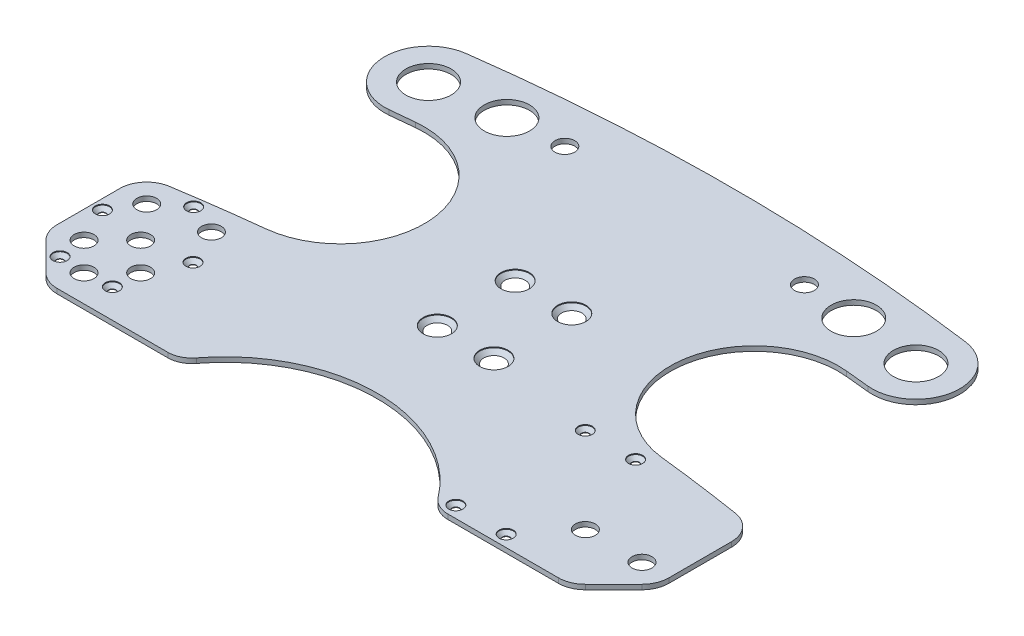
from build123d import *

# Parameters (mm, degrees)
SKETCH1_R                                      = 2.5
BOSS_EXTRUDE1_DEPTH                            = 1.7
CUT_EXTRUDE1_REACH                             = 155.062
SKETCH2_R                                      = 3.5
SKETCH2_R_2                                    = 8
CUT_EXTRUDE2_REACH                             = 155.062
SKETCH3_R                                      = 1.3
CUT_EXTRUDE3_REACH                             = 136.744
SKETCH8_R                                      = 1.25
CSK_FOR_M5_FLAT_HEAD_MACHINE_SCREW1_AT_2_COUNT = 2
CSK_FOR_M5_FLAT_HEAD_MACHINE_SCREW1_AT_2_PITCH = 20
CSK_FOR_M5_FLAT_HEAD_MACHINE_SCREW1_AT_3_COUNT = 2
CSK_FOR_M5_FLAT_HEAD_MACHINE_SCREW1_AT_3_PITCH = 34.003676272
CSK_FOR_M5_FLAT_HEAD_MACHINE_SCREW1_AT_4_COUNT = 2
CSK_FOR_M5_FLAT_HEAD_MACHINE_SCREW1_AT_4_PITCH = 27.5
CSK_FOR_M2_5_FLAT_HEAD_MACHINE_SCREW1_AT_COUNT = 2
CSK_FOR_M2_5_FLAT_HEAD_MACHINE_SCREW1_AT_PITCH = 17.78
CSK_FOR_M2_5_FLAT_HEAD_MACHINE_SCREW_2_COUNT   = 2
CSK_FOR_M2_5_FLAT_HEAD_MACHINE_SCREW_2_PITCH   = 49.055548106
CSK_FOR_M2_5_FLAT_HEAD_MACHINE_SCREW_3_COUNT   = 2
CSK_FOR_M2_5_FLAT_HEAD_MACHINE_SCREW_3_PITCH   = 45.72
CSK_FOR_M2_5_FLAT_HEAD_MACHINE_SCREW_4_COUNT   = 2
CSK_FOR_M2_5_FLAT_HEAD_MACHINE_SCREW_4_PITCH   = 137.555030632
CSK_FOR_M2_5_FLAT_HEAD_MACHINE_SCREW_5_COUNT   = 2
CSK_FOR_M2_5_FLAT_HEAD_MACHINE_SCREW_5_PITCH   = 122.005515158
CSK_FOR_M2_5_FLAT_HEAD_MACHINE_SCREW_6_COUNT   = 2
CSK_FOR_M2_5_FLAT_HEAD_MACHINE_SCREW_6_PITCH   = 153.732178243
CSK_FOR_M2_5_FLAT_HEAD_MACHINE_SCREW_7_COUNT   = 2
CSK_FOR_M2_5_FLAT_HEAD_MACHINE_SCREW_7_PITCH   = 151.211955401
CSK_FOR_M2_5_FLAT_HEAD_MACHINE_SCREW_8_COUNT   = 2
CSK_FOR_M2_5_FLAT_HEAD_MACHINE_SCREW_8_PITCH   = 133.459749785
FILLET1_R                                      = 8.5


with BuildPart() as part:
    # Sketch1 → Boss-Extrude1 (new body)
    with BuildSketch(Plane(origin=(0, 0, 0), x_dir=(1, 0, 0), z_dir=(0, 1, 0))):
        with BuildLine():
            Line((-73.314391493, -95), (73.314391493, -95))
            ThreePointArc((73.314391493, -95), (120, 0), (73.314391493, 95))
            Line((73.314391493, 95), (-73.314391493, 95))
            ThreePointArc((-73.314391493, 95), (-120, 0), (-73.314391493, -95))
        make_face()
        with Locations((-10, 13.75)):
            Circle(SKETCH1_R, mode=Mode.SUBTRACT)
        with Locations((-10, -13.75)):
            Circle(SKETCH1_R, mode=Mode.SUBTRACT)
        with Locations((10, -13.75)):
            Circle(SKETCH1_R, mode=Mode.SUBTRACT)
        with Locations((10, 13.75)):
            Circle(SKETCH1_R, mode=Mode.SUBTRACT)
    extrude(amount=BOSS_EXTRUDE1_DEPTH)

    # Sketch2 → Cut-Extrude1 (cut, up to next)
    with BuildSketch(Plane(origin=(0, 1.7, 0), x_dir=(1, 0, 0), z_dir=(0, 1, 0)), mode=Mode.PRIVATE) as cut_extrude1_sk1:
        with Locations((-88.540600769, -40)):
            Circle(SKETCH2_R)
    cut_extrude1_tool1 = extrude(cut_extrude1_sk1.sketch, amount=-CUT_EXTRUDE1_REACH, mode=Mode.PRIVATE) & part.part
    # Sketch2 → Cut-Extrude1 (cut, up to next)
    with BuildSketch(Plane(origin=(0, 1.7, 0), x_dir=(1, 0, 0), z_dir=(0, 1, 0)), mode=Mode.PRIVATE) as cut_extrude1_sk2:
        with Locations((-78.540600769, -50)):
            Circle(SKETCH2_R)
    cut_extrude1_tool2 = extrude(cut_extrude1_sk2.sketch, amount=-CUT_EXTRUDE1_REACH, mode=Mode.PRIVATE) & part.part
    # Sketch2 → Cut-Extrude1 (cut, up to next)
    with BuildSketch(Plane(origin=(0, 1.7, 0), x_dir=(1, 0, 0), z_dir=(0, 1, 0)), mode=Mode.PRIVATE) as cut_extrude1_sk3:
        with Locations((-88.540600769, -60)):
            Circle(SKETCH2_R)
    cut_extrude1_tool3 = extrude(cut_extrude1_sk3.sketch, amount=-CUT_EXTRUDE1_REACH, mode=Mode.PRIVATE) & part.part
    # Sketch2 → Cut-Extrude1 (cut, up to next)
    with BuildSketch(Plane(origin=(0, 1.7, 0), x_dir=(1, 0, 0), z_dir=(0, 1, 0)), mode=Mode.PRIVATE) as cut_extrude1_sk4:
        with Locations((-98.540600769, -50)):
            Circle(SKETCH2_R)
    cut_extrude1_tool4 = extrude(cut_extrude1_sk4.sketch, amount=-CUT_EXTRUDE1_REACH, mode=Mode.PRIVATE) & part.part
    # Sketch2 → Cut-Extrude1 (cut, up to next)
    with BuildSketch(Plane(origin=(0, 1.7, 0), x_dir=(1, 0, 0), z_dir=(0, 1, 0)), mode=Mode.PRIVATE) as cut_extrude1_sk5:
        with Locations((78.540600769, -50)):
            Circle(SKETCH2_R)
    cut_extrude1_tool5 = extrude(cut_extrude1_sk5.sketch, amount=-CUT_EXTRUDE1_REACH, mode=Mode.PRIVATE) & part.part
    # Sketch2 → Cut-Extrude1 (cut, up to next)
    with BuildSketch(Plane(origin=(0, 1.7, 0), x_dir=(1, 0, 0), z_dir=(0, 1, 0)), mode=Mode.PRIVATE) as cut_extrude1_sk6:
        with Locations((98.540600769, -50)):
            Circle(SKETCH2_R)
    cut_extrude1_tool6 = extrude(cut_extrude1_sk6.sketch, amount=-CUT_EXTRUDE1_REACH, mode=Mode.PRIVATE) & part.part
    # Sketch2 → Cut-Extrude1 (cut, up to next)
    with BuildSketch(Plane(origin=(0, 1.7, 0), x_dir=(1, 0, 0), z_dir=(0, 1, 0)), mode=Mode.PRIVATE) as cut_extrude1_sk7:
        with Locations((-98.540600769, -27.862546721)):
            Circle(SKETCH2_R)
    cut_extrude1_tool7 = extrude(cut_extrude1_sk7.sketch, amount=-CUT_EXTRUDE1_REACH, mode=Mode.PRIVATE) & part.part
    # Sketch2 → Cut-Extrude1 (cut, up to next)
    with BuildSketch(Plane(origin=(0, 1.7, 0), x_dir=(1, 0, 0), z_dir=(0, 1, 0)), mode=Mode.PRIVATE) as cut_extrude1_sk8:
        with Locations((-78.540600769, -25)):
            Circle(SKETCH2_R)
    cut_extrude1_tool8 = extrude(cut_extrude1_sk8.sketch, amount=-CUT_EXTRUDE1_REACH, mode=Mode.PRIVATE) & part.part
    # Sketch2 → Cut-Extrude1 (cut, up to next)
    with BuildSketch(Plane(origin=(0, 1.7, 0), x_dir=(1, 0, 0), z_dir=(0, 1, 0)), mode=Mode.PRIVATE) as cut_extrude1_sk9:
        with Locations((-86.094520408, 59.228232759)):
            Circle(SKETCH2_R_2)
    cut_extrude1_tool9 = extrude(cut_extrude1_sk9.sketch, amount=-CUT_EXTRUDE1_REACH, mode=Mode.PRIVATE) & part.part
    # Sketch2 → Cut-Extrude1 (cut, up to next)
    with BuildSketch(Plane(origin=(0, 1.7, 0), x_dir=(1, 0, 0), z_dir=(0, 1, 0)), mode=Mode.PRIVATE) as cut_extrude1_sk10:
        with Locations((-61.259580586, 62.084312054)):
            Circle(SKETCH2_R_2)
    cut_extrude1_tool10 = extrude(cut_extrude1_sk10.sketch, amount=-CUT_EXTRUDE1_REACH, mode=Mode.PRIVATE) & part.part
    # Sketch2 → Cut-Extrude1 (cut, up to next)
    with BuildSketch(Plane(origin=(0, 1.7, 0), x_dir=(1, 0, 0), z_dir=(0, 1, 0)), mode=Mode.PRIVATE) as cut_extrude1_sk11:
        with Locations((61.259580586, 62.084312054)):
            Circle(SKETCH2_R_2)
    cut_extrude1_tool11 = extrude(cut_extrude1_sk11.sketch, amount=-CUT_EXTRUDE1_REACH, mode=Mode.PRIVATE) & part.part
    # Sketch2 → Cut-Extrude1 (cut, up to next)
    with BuildSketch(Plane(origin=(0, 1.7, 0), x_dir=(1, 0, 0), z_dir=(0, 1, 0)), mode=Mode.PRIVATE) as cut_extrude1_sk12:
        with Locations((86.094520408, 59.228232759)):
            Circle(SKETCH2_R_2)
    cut_extrude1_tool12 = extrude(cut_extrude1_sk12.sketch, amount=-CUT_EXTRUDE1_REACH, mode=Mode.PRIVATE) & part.part
    # Sketch2 → Cut-Extrude1 (cut, up to next)
    with BuildSketch(Plane(origin=(0, 1.7, 0), x_dir=(1, 0, 0), z_dir=(0, 1, 0)), mode=Mode.PRIVATE) as cut_extrude1_sk13:
        with Locations((-42.320942156, 63.610082158)):
            Circle(SKETCH2_R)
    cut_extrude1_tool13 = extrude(cut_extrude1_sk13.sketch, amount=-CUT_EXTRUDE1_REACH, mode=Mode.PRIVATE) & part.part
    # Sketch2 → Cut-Extrude1 (cut, up to next)
    with BuildSketch(Plane(origin=(0, 1.7, 0), x_dir=(1, 0, 0), z_dir=(0, 1, 0)), mode=Mode.PRIVATE) as cut_extrude1_sk14:
        with Locations((42.320942156, 63.610082158)):
            Circle(SKETCH2_R)
    cut_extrude1_tool14 = extrude(cut_extrude1_sk14.sketch, amount=-CUT_EXTRUDE1_REACH, mode=Mode.PRIVATE) & part.part
    add(cut_extrude1_tool1.solids().sort_by_distance((-88.540601, 1.7, 40))[0], mode=Mode.SUBTRACT)
    add(cut_extrude1_tool2.solids().sort_by_distance((-78.540601, 1.7, 50))[0], mode=Mode.SUBTRACT)
    add(cut_extrude1_tool3.solids().sort_by_distance((-88.540601, 1.7, 60))[0], mode=Mode.SUBTRACT)
    add(cut_extrude1_tool4.solids().sort_by_distance((-98.540601, 1.7, 50))[0], mode=Mode.SUBTRACT)
    add(cut_extrude1_tool5.solids().sort_by_distance((78.540601, 1.7, 50))[0], mode=Mode.SUBTRACT)
    add(cut_extrude1_tool6.solids().sort_by_distance((98.540601, 1.7, 50))[0], mode=Mode.SUBTRACT)
    add(cut_extrude1_tool7.solids().sort_by_distance((-98.540601, 1.7, 27.862547))[0], mode=Mode.SUBTRACT)
    add(cut_extrude1_tool8.solids().sort_by_distance((-78.540601, 1.7, 25))[0], mode=Mode.SUBTRACT)
    add(cut_extrude1_tool9.solids().sort_by_distance((-86.09452, 1.7, -59.228233))[0], mode=Mode.SUBTRACT)
    add(cut_extrude1_tool10.solids().sort_by_distance((-61.259581, 1.7, -62.084312))[0], mode=Mode.SUBTRACT)
    add(cut_extrude1_tool11.solids().sort_by_distance((61.259581, 1.7, -62.084312))[0], mode=Mode.SUBTRACT)
    add(cut_extrude1_tool12.solids().sort_by_distance((86.09452, 1.7, -59.228233))[0], mode=Mode.SUBTRACT)
    add(cut_extrude1_tool13.solids().sort_by_distance((-42.320942, 1.7, -63.610082))[0], mode=Mode.SUBTRACT)
    add(cut_extrude1_tool14.solids().sort_by_distance((42.320942, 1.7, -63.610082))[0], mode=Mode.SUBTRACT)

    # Sketch3 → Cut-Extrude2 (cut, up to next)
    with BuildSketch(Plane(origin=(0, 1.7, 0), x_dir=(1, 0, 0), z_dir=(0, 1, 0)), mode=Mode.PRIVATE) as cut_extrude2_sk1:
        with BuildLine():
            Line((-76.105927639, 44.650651409), (-84.550645906, 43.805313077))
            ThreePointArc((-84.550645906, 43.805313077), (-99.436668511, 51.3391844), (-98.864520746, 68.013282068))
            ThreePointArc((-98.864520746, 68.013282068), (-119.734623685, 7.97620781), (-107.012417284, -54.298642221))
            ThreePointArc((-107.012417284, -54.298642221), (-107.779979993, -52.209948315), (-108.040600769, -50))
            Line((-108.040600769, -50), (-108.040600769, -27.862546721))
            ThreePointArc((-108.040600769, -27.862546721), (-105.768300058, -21.697292226), (-100.038419088, -18.48136661))
            ThreePointArc((-100.038419088, -18.48136661), (-84.982869073, -16.262381047), (-69.878431936, -14.405108326))
            ThreePointArc((-69.878431936, -14.405108326), (-43.620166551, 18.220083083), (-76.105927639, 44.650651409))
        make_face()
    cut_extrude2_tool1 = extrude(cut_extrude2_sk1.sketch, amount=-CUT_EXTRUDE2_REACH, mode=Mode.PRIVATE) & part.part
    # Sketch3 → Cut-Extrude2 (cut, up to next)
    with BuildSketch(Plane(origin=(0, 1.7, 0), x_dir=(1, 0, 0), z_dir=(0, 1, 0)), mode=Mode.PRIVATE) as cut_extrude2_sk2:
        with BuildLine():
            ThreePointArc((-98.864520746, 68.013282068), (-94.209947077, 72.433907674), (-88.163438842, 74.589534022))
            ThreePointArc((-88.163438842, 74.589534022), (2.1e-08, 80.5), (88.163438884, 74.589534017))
            ThreePointArc((88.163438884, 74.589534017), (94.209947407, 72.433907471), (98.864521161, 68.013281465))
            ThreePointArc((98.864521161, 68.013281465), (87.140491363, 82.50172583), (73.314391493, 95))
            Line((73.314391493, 95), (-73.314391493, 95))
            ThreePointArc((-73.314391493, 95), (-87.140491112, 82.501726096), (-98.864520746, 68.013282068))
        make_face()
    cut_extrude2_tool2 = extrude(cut_extrude2_sk2.sketch, amount=-CUT_EXTRUDE2_REACH, mode=Mode.PRIVATE) & part.part
    # Sketch3 → Cut-Extrude2 (cut, up to next)
    with BuildSketch(Plane(origin=(0, 1.7, 0), x_dir=(1, 0, 0), z_dir=(0, 1, 0)), mode=Mode.PRIVATE) as cut_extrude2_sk3:
        with BuildLine():
            ThreePointArc((-105.258115191, -56.717514421), (-106.230963521, -55.577483371), (-107.012417284, -54.298642221))
            ThreePointArc((-107.012417284, -54.298642221), (-92.431540192, -76.527187181), (-73.314391493, -95))
            Line((-73.314391493, -95), (73.314391493, -95))
            ThreePointArc((73.314391493, -95), (92.431540082, -76.527187314), (107.012417128, -54.298642528))
            ThreePointArc((107.012417128, -54.298642528), (106.23096342, -55.57748351), (105.258115191, -56.717514421))
            Line((105.258115191, -56.717514421), (95.258115191, -66.717514421))
            ThreePointArc((95.258115191, -66.717514421), (92.176093377, -68.776855559), (88.540600769, -69.5))
            Line((88.540600769, -69.5), (45.040600769, -69.5))
            ThreePointArc((45.040600769, -69.5), (0, -45), (-45.040600769, -69.5))
            Line((-45.040600769, -69.5), (-88.540600769, -69.5))
            ThreePointArc((-88.540600769, -69.5), (-92.176093377, -68.776855559), (-95.258115191, -66.717514421))
            Line((-95.258115191, -66.717514421), (-105.258115191, -56.717514421))
        make_face()
    cut_extrude2_tool3 = extrude(cut_extrude2_sk3.sketch, amount=-CUT_EXTRUDE2_REACH, mode=Mode.PRIVATE) & part.part
    # Sketch3 → Cut-Extrude2 (cut, up to next)
    with BuildSketch(Plane(origin=(0, 1.7, 0), x_dir=(1, 0, 0), z_dir=(0, 1, 0)), mode=Mode.PRIVATE) as cut_extrude2_sk4:
        with BuildLine():
            ThreePointArc((69.878433596, -14.40510851), (84.982869339, -16.262381083), (100.038417968, -18.481366431))
            ThreePointArc((100.038417968, -18.481366431), (105.768299691, -21.697291795), (108.040600769, -27.862546721))
            Line((108.040600769, -27.862546721), (108.040600769, -50))
            ThreePointArc((108.040600769, -50), (107.779979953, -52.209948483), (107.012417128, -54.298642528))
            ThreePointArc((107.012417128, -54.298642528), (119.734623721, 7.976207273), (98.864521161, 68.013281465))
            ThreePointArc((98.864521161, 68.013281465), (99.436668324, 51.339184085), (84.550645906, 43.805313077))
            Line((84.550645906, 43.805313077), (76.105927251, 44.650651448))
            ThreePointArc((76.105927251, 44.650651448), (43.620166443, 18.220082059), (69.878433596, -14.40510851))
        make_face()
    cut_extrude2_tool4 = extrude(cut_extrude2_sk4.sketch, amount=-CUT_EXTRUDE2_REACH, mode=Mode.PRIVATE) & part.part
    # Sketch3 → Cut-Extrude2 (cut, up to next)
    with BuildSketch(Plane(origin=(0, 1.7, 0), x_dir=(1, 0, 0), z_dir=(0, 1, 0)), mode=Mode.PRIVATE) as cut_extrude2_sk5:
        with Locations((48.150600769, -19.64)):
            Circle(SKETCH3_R)
    cut_extrude2_tool5 = extrude(cut_extrude2_sk5.sketch, amount=-CUT_EXTRUDE2_REACH, mode=Mode.PRIVATE) & part.part
    # Sketch3 → Cut-Extrude2 (cut, up to next)
    with BuildSketch(Plane(origin=(0, 1.7, 0), x_dir=(1, 0, 0), z_dir=(0, 1, 0)), mode=Mode.PRIVATE) as cut_extrude2_sk6:
        with Locations((65.930600769, -19.64)):
            Circle(SKETCH3_R)
    cut_extrude2_tool6 = extrude(cut_extrude2_sk6.sketch, amount=-CUT_EXTRUDE2_REACH, mode=Mode.PRIVATE) & part.part
    # Sketch3 → Cut-Extrude2 (cut, up to next)
    with BuildSketch(Plane(origin=(0, 1.7, 0), x_dir=(1, 0, 0), z_dir=(0, 1, 0)), mode=Mode.PRIVATE) as cut_extrude2_sk7:
        with Locations((65.930600769, -65.36)):
            Circle(SKETCH3_R)
    cut_extrude2_tool7 = extrude(cut_extrude2_sk7.sketch, amount=-CUT_EXTRUDE2_REACH, mode=Mode.PRIVATE) & part.part
    # Sketch3 → Cut-Extrude2 (cut, up to next)
    with BuildSketch(Plane(origin=(0, 1.7, 0), x_dir=(1, 0, 0), z_dir=(0, 1, 0)), mode=Mode.PRIVATE) as cut_extrude2_sk8:
        with Locations((48.150600769, -65.36)):
            Circle(SKETCH3_R)
    cut_extrude2_tool8 = extrude(cut_extrude2_sk8.sketch, amount=-CUT_EXTRUDE2_REACH, mode=Mode.PRIVATE) & part.part
    add(cut_extrude2_tool1.solids().sort_by_distance((-86.043963, 1.7, -12.513289))[0], mode=Mode.SUBTRACT)
    add(cut_extrude2_tool2.solids().sort_by_distance((0, 1.7, -86.177495))[0], mode=Mode.SUBTRACT)
    add(cut_extrude2_tool3.solids().sort_by_distance((0, 1.7, 75.736765))[0], mode=Mode.SUBTRACT)
    add(cut_extrude2_tool4.solids().sort_by_distance((86.043963, 1.7, -12.513289))[0], mode=Mode.SUBTRACT)
    add(cut_extrude2_tool5.solids().sort_by_distance((48.150601, 1.7, 19.64))[0], mode=Mode.SUBTRACT)
    add(cut_extrude2_tool6.solids().sort_by_distance((65.930601, 1.7, 19.64))[0], mode=Mode.SUBTRACT)
    add(cut_extrude2_tool7.solids().sort_by_distance((65.930601, 1.7, 65.36))[0], mode=Mode.SUBTRACT)
    add(cut_extrude2_tool8.solids().sort_by_distance((48.150601, 1.7, 65.36))[0], mode=Mode.SUBTRACT)

    # Sketch8 → Cut-Extrude3 (cut, up to next)
    with BuildSketch(Plane(origin=(0, 1.7, 0), x_dir=(1, 0, 0), z_dir=(0, 1, 0)), mode=Mode.PRIVATE) as cut_extrude3_sk1:
        with Locations((-89.402269215, -20.410980738)):
            Circle(SKETCH8_R)
    cut_extrude3_tool1 = extrude(cut_extrude3_sk1.sketch, amount=-CUT_EXTRUDE3_REACH, mode=Mode.PRIVATE) & part.part
    # Sketch8 → Cut-Extrude3 (cut, up to next)
    with BuildSketch(Plane(origin=(0, 1.7, 0), x_dir=(1, 0, 0), z_dir=(0, 1, 0)), mode=Mode.PRIVATE) as cut_extrude3_sk2:
        with Locations((-104.540600769, -37.5)):
            Circle(SKETCH8_R)
    cut_extrude3_tool2 = extrude(cut_extrude3_sk2.sketch, amount=-CUT_EXTRUDE3_REACH, mode=Mode.PRIVATE) & part.part
    # Sketch8 → Cut-Extrude3 (cut, up to next)
    with BuildSketch(Plane(origin=(0, 1.7, 0), x_dir=(1, 0, 0), z_dir=(0, 1, 0)), mode=Mode.PRIVATE) as cut_extrude3_sk3:
        with Locations((-72.540600769, -37.5)):
            Circle(SKETCH8_R)
    cut_extrude3_tool3 = extrude(cut_extrude3_sk3.sketch, amount=-CUT_EXTRUDE3_REACH, mode=Mode.PRIVATE) & part.part
    # Sketch8 → Cut-Extrude3 (cut, up to next)
    with BuildSketch(Plane(origin=(0, 1.7, 0), x_dir=(1, 0, 0), z_dir=(0, 1, 0)), mode=Mode.PRIVATE) as cut_extrude3_sk4:
        with Locations((-97.783241457, -59.242640687)):
            Circle(SKETCH8_R)
    cut_extrude3_tool4 = extrude(cut_extrude3_sk4.sketch, amount=-CUT_EXTRUDE3_REACH, mode=Mode.PRIVATE) & part.part
    # Sketch8 → Cut-Extrude3 (cut, up to next)
    with BuildSketch(Plane(origin=(0, 1.7, 0), x_dir=(1, 0, 0), z_dir=(0, 1, 0)), mode=Mode.PRIVATE) as cut_extrude3_sk5:
        with Locations((-79.297960082, -59.242640687)):
            Circle(SKETCH8_R)
    cut_extrude3_tool5 = extrude(cut_extrude3_sk5.sketch, amount=-CUT_EXTRUDE3_REACH, mode=Mode.PRIVATE) & part.part
    add(cut_extrude3_tool1.solids().sort_by_distance((-89.402269, 1.7, 20.410981))[0], mode=Mode.SUBTRACT)
    add(cut_extrude3_tool2.solids().sort_by_distance((-104.540601, 1.7, 37.5))[0], mode=Mode.SUBTRACT)
    add(cut_extrude3_tool3.solids().sort_by_distance((-72.540601, 1.7, 37.5))[0], mode=Mode.SUBTRACT)
    add(cut_extrude3_tool4.solids().sort_by_distance((-97.783241, 1.7, 59.242641))[0], mode=Mode.SUBTRACT)
    add(cut_extrude3_tool5.solids().sort_by_distance((-79.29796, 1.7, 59.242641))[0], mode=Mode.SUBTRACT)

    # Sketch5 → CSK for M5 Flat Head Machine Screw1 (revolve, cut)
    with BuildSketch(Plane(origin=(-10, 1.7, -13.75), x_dir=(0, 0, 1), z_dir=(1, 0, 0))):
        Polygon((0, 0), (0, 6.502151548), (2.5, 5), (2.5, 2.8), (5, 0.3), (5, 0), align=None)
    csk_for_m5_flat_head_machine_screw1 = revolve(axis=Axis((-10, 8.05, -13.75), (0, -1, 0)), mode=Mode.SUBTRACT)

    # CSK for M5 Flat Head Machine Screw1 at 2: CSK for M5 Flat Head Machine Screw1 ×2
    with Locations(*[(i * CSK_FOR_M5_FLAT_HEAD_MACHINE_SCREW1_AT_2_PITCH, 0, 0) for i in range(1, CSK_FOR_M5_FLAT_HEAD_MACHINE_SCREW1_AT_2_COUNT)]):
        add(csk_for_m5_flat_head_machine_screw1, mode=Mode.SUBTRACT)

    # CSK for M5 Flat Head Machine Screw1 at 3: CSK for M5 Flat Head Machine Screw1 ×2
    with Locations(*[Vector(0.5881716976750462, 0, 0.8087360843031886) * (i * CSK_FOR_M5_FLAT_HEAD_MACHINE_SCREW1_AT_3_PITCH) for i in range(1, CSK_FOR_M5_FLAT_HEAD_MACHINE_SCREW1_AT_3_COUNT)]):
        add(csk_for_m5_flat_head_machine_screw1, mode=Mode.SUBTRACT)

    # CSK for M5 Flat Head Machine Screw1 at 4: CSK for M5 Flat Head Machine Screw1 ×2
    with Locations(*[(0, 0, i * CSK_FOR_M5_FLAT_HEAD_MACHINE_SCREW1_AT_4_PITCH) for i in range(1, CSK_FOR_M5_FLAT_HEAD_MACHINE_SCREW1_AT_4_COUNT)]):
        add(csk_for_m5_flat_head_machine_screw1, mode=Mode.SUBTRACT)

    # Sketch7 → CSK for M2.5 Flat Head Machine Screw1 (revolve, cut)
    with BuildSketch(Plane(origin=(48.150600769, 1.7, 19.64), x_dir=(0, 0, 1), z_dir=(1, 0, 0))):
        Polygon((0, 0), (0, 5.751075774), (1.25, 5), (1.25, 1.55), (2.5, 0.3), (2.5, 0), align=None)
    csk_for_m2_5_flat_head_machine_screw1 = revolve(axis=Axis((48.150600769, 8.05, 19.64), (0, -1, 0)), mode=Mode.SUBTRACT)

    # CSK for M2.5 Flat Head Machine Screw1 at: CSK for M2.5 Flat Head Machine Screw1 ×2
    with Locations(*[(i * CSK_FOR_M2_5_FLAT_HEAD_MACHINE_SCREW1_AT_PITCH, 0, 0) for i in range(1, CSK_FOR_M2_5_FLAT_HEAD_MACHINE_SCREW1_AT_COUNT)]):
        add(csk_for_m2_5_flat_head_machine_screw1, mode=Mode.SUBTRACT)

    # CSK for M2.5 Flat Head Machine Screw 2: CSK for M2.5 Flat Head Machine Screw1 ×2
    with Locations(*[Vector(0.3624462611549487, 0, 0.9320046715412958) * (i * CSK_FOR_M2_5_FLAT_HEAD_MACHINE_SCREW_2_PITCH) for i in range(1, CSK_FOR_M2_5_FLAT_HEAD_MACHINE_SCREW_2_COUNT)]):
        add(csk_for_m2_5_flat_head_machine_screw1, mode=Mode.SUBTRACT)

    # CSK for M2.5 Flat Head Machine Screw 3: CSK for M2.5 Flat Head Machine Screw1 ×2
    with Locations(*[(0, 0, i * CSK_FOR_M2_5_FLAT_HEAD_MACHINE_SCREW_3_PITCH) for i in range(1, CSK_FOR_M2_5_FLAT_HEAD_MACHINE_SCREW_3_COUNT)]):
        add(csk_for_m2_5_flat_head_machine_screw1, mode=Mode.SUBTRACT)

    # CSK for M2.5 Flat Head Machine Screw 4: CSK for M2.5 Flat Head Machine Screw1 ×2
    with Locations(*[Vector(-0.999984292483863, 0, 0.005604889432271748) * (i * CSK_FOR_M2_5_FLAT_HEAD_MACHINE_SCREW_4_PITCH) for i in range(1, CSK_FOR_M2_5_FLAT_HEAD_MACHINE_SCREW_4_COUNT)]):
        add(csk_for_m2_5_flat_head_machine_screw1, mode=Mode.SUBTRACT)

    # CSK for M2.5 Flat Head Machine Screw 5: CSK for M2.5 Flat Head Machine Screw1 ×2
    with Locations(*[Vector(-0.9892274245378749, 0, 0.14638682502931377) * (i * CSK_FOR_M2_5_FLAT_HEAD_MACHINE_SCREW_5_PITCH) for i in range(1, CSK_FOR_M2_5_FLAT_HEAD_MACHINE_SCREW_5_COUNT)]):
        add(csk_for_m2_5_flat_head_machine_screw1, mode=Mode.SUBTRACT)

    # CSK for M2.5 Flat Head Machine Screw 6: CSK for M2.5 Flat Head Machine Screw1 ×2
    with Locations(*[Vector(-0.9932286349144532, 0, 0.1161760680431725) * (i * CSK_FOR_M2_5_FLAT_HEAD_MACHINE_SCREW_6_PITCH) for i in range(1, CSK_FOR_M2_5_FLAT_HEAD_MACHINE_SCREW_6_COUNT)]):
        add(csk_for_m2_5_flat_head_machine_screw1, mode=Mode.SUBTRACT)

    # CSK for M2.5 Flat Head Machine Screw 7: CSK for M2.5 Flat Head Machine Screw1 ×2
    with Locations(*[Vector(-0.9650946040533703, 0, 0.2619015181839699) * (i * CSK_FOR_M2_5_FLAT_HEAD_MACHINE_SCREW_7_PITCH) for i in range(1, CSK_FOR_M2_5_FLAT_HEAD_MACHINE_SCREW_7_COUNT)]):
        add(csk_for_m2_5_flat_head_machine_screw1, mode=Mode.SUBTRACT)

    # CSK for M2.5 Flat Head Machine Screw 8: CSK for M2.5 Flat Head Machine Screw1 ×2
    with Locations(*[Vector(-0.9549587876301365, 0, 0.2967384604798977) * (i * CSK_FOR_M2_5_FLAT_HEAD_MACHINE_SCREW_8_PITCH) for i in range(1, CSK_FOR_M2_5_FLAT_HEAD_MACHINE_SCREW_8_COUNT)]):
        add(csk_for_m2_5_flat_head_machine_screw1, mode=Mode.SUBTRACT)

    # Fillet1
    fillet1_edges = [part.edges().sort_by_distance(p)[0] for p in [
        (45.040600769, 0.85, 69.5),
        (-45.040600769, 0.85, 69.5),
    ]]
    fillet(fillet1_edges, radius=FILLET1_R)


solid = part.part
